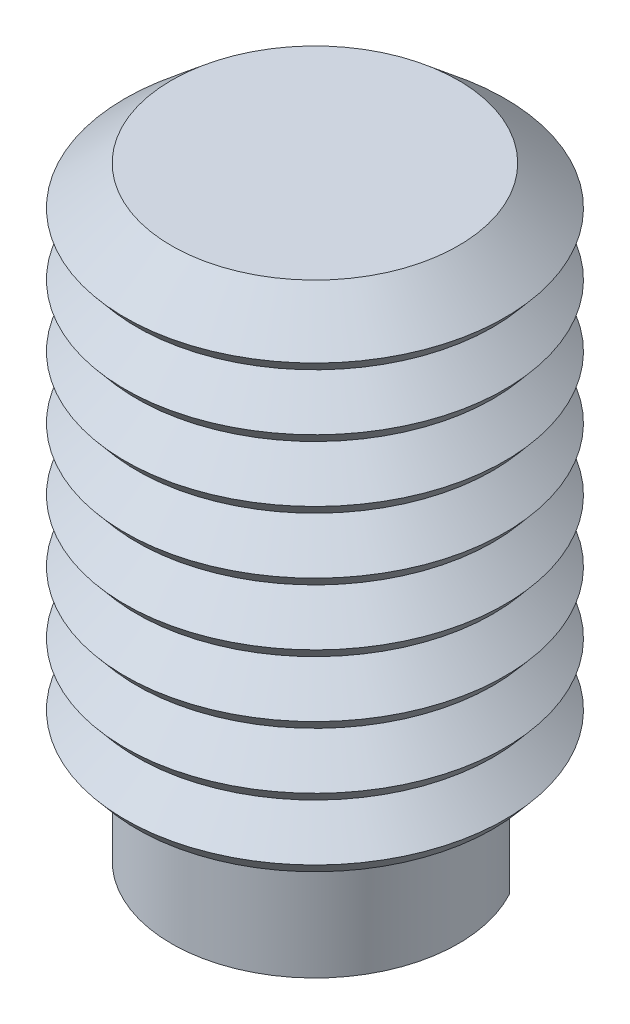
from build123d import *

# Parameters (mm, degrees)
SKETCH2_R                      = 8.45
CUT_EXTRUDE1_DEPTH             = 39
SKETCH3_W                      = 17.301460939
SKETCH3_H                      = 2.833887043
BOSS_EXTRUDE1_DEPTH            = 0.25
CUT_EXTRUDE2_REACH             = 41.416
SKETCH4_R                      = 1
CUT_EXTRUDE2_DIRECTION_2_DEPTH = 6
BOSS_EXTRUDE6_DEPTH            = 0.25
CUT_EXTRUDE5_REACH             = 43.334
SKETCH19_R                     = 1
CUT_EXTRUDE5_DIRECTION_2_REACH = 43.334
BOSS_EXTRUDE14_DEPTH           = 0.25
CUT_EXTRUDE9_REACH             = 41.831
SKETCH30_R                     = 1
CUT_EXTRUDE9_DIRECTION_2_REACH = 41.831
SKETCH33_R                     = 11.45
SKETCH33_R_2                   = 8.45
BOSS_EXTRUDE15_DEPTH           = 2
CUT_EXTRUDE11_START            = -6
CUT_EXTRUDE11_DEPTH            = 6
CUT_EXTRUDE12_START            = -6
CUT_EXTRUDE12_DEPTH            = 6


with BuildPart() as part:
    # Sketch1 → Revolve1 (revolve)
    with BuildSketch(Plane.XY):
        Polygon((0, -10.882512798), (0, -13.182512798), (-11.45, -13.182512798), (-11.45, -3.589289336), (-14.195818585, -5.893304698), (-15.16, -4.744238033), (-11.45, -1.631178402), (-11.45, 1.368821598), (-14.195818585, -0.935193764), (-15.16, 0.213872901), (-11.45, 3.326932532), (-11.45, 6.326932532), (-14.195818585, 4.02291717), (-15.16, 5.171983835), (-11.45, 8.285043466), (-11.45, 11.285043466), (-14.195818585, 8.981028104), (-15.16, 10.130094769), (-11.45, 13.2431544), (-11.45, 16.2431544), (-14.195818585, 13.939139038), (-15.16, 15.088205703), (-11.45, 18.201265334), (-11.45, 21.201265334), (-14.195818585, 18.897249972), (-15.16, 20.046316637), (-11.45, 23.159376268), (-11.45, 26.159376268), (-14.195818585, 23.855360906), (-15.16, 25.004427571), (-11.45, 28.117487202), (-11.45, 31.117487202), (-14.195818585, 28.81347184), (-15.16, 29.962538505), (-11.45, 33.075598136), (0, 33.075598136), (0, 31.117487202), (-10, 31.117487202), (-10, -10.882512798), align=None)
    revolve(axis=Axis((0, 33.075598136, 0), (0, -1, 0)))

    # Sketch2 → Cut-Extrude1 (cut)
    with BuildSketch(Plane.XZ.offset(13.182512798)):
        Circle(SKETCH2_R)
    extrude(amount=-CUT_EXTRUDE1_DEPTH, mode=Mode.SUBTRACT)

    # Sketch3 → Boss-Extrude1 (add)
    with BuildSketch(Plane.XZ.offset(-31.117487202)):
        with Locations((2.443032834, -1.416943522)):
            Rectangle(SKETCH3_W, SKETCH3_H)
    extrude(amount=BOSS_EXTRUDE1_DEPTH)

    # Sketch4 → Cut-Extrude2 (cut, up to next)
    with BuildSketch(Plane.XY, mode=Mode.PRIVATE) as cut_extrude2_sk1:
        with Locations((-1.027932202, 9.533260315)):
            Circle(SKETCH4_R)
    cut_extrude2_tool1 = extrude(cut_extrude2_sk1.sketch, amount=-CUT_EXTRUDE2_REACH, mode=Mode.PRIVATE) & part.part
    # Sketch4 → Cut-Extrude2 (cut, up to next)
    with BuildSketch(Plane.XY, mode=Mode.PRIVATE) as cut_extrude2_sk2:
        with Locations((3.972067798, 9.533260315)):
            Circle(SKETCH4_R)
    cut_extrude2_tool2 = extrude(cut_extrude2_sk2.sketch, amount=-CUT_EXTRUDE2_REACH, mode=Mode.PRIVATE) & part.part
    # Sketch4 → Cut-Extrude2 (cut, up to next)
    with BuildSketch(Plane.XY, mode=Mode.PRIVATE) as cut_extrude2_sk3:
        with Locations((-1.027932202, 14.533260315)):
            Circle(SKETCH4_R)
    cut_extrude2_tool3 = extrude(cut_extrude2_sk3.sketch, amount=-CUT_EXTRUDE2_REACH, mode=Mode.PRIVATE) & part.part
    # Sketch4 → Cut-Extrude2 (cut, up to next)
    with BuildSketch(Plane.XY, mode=Mode.PRIVATE) as cut_extrude2_sk4:
        with Locations((3.972067798, 14.533260315)):
            Circle(SKETCH4_R)
    cut_extrude2_tool4 = extrude(cut_extrude2_sk4.sketch, amount=-CUT_EXTRUDE2_REACH, mode=Mode.PRIVATE) & part.part
    # Sketch4 → Cut-Extrude2 (cut, up to next)
    with BuildSketch(Plane.XY, mode=Mode.PRIVATE) as cut_extrude2_sk5:
        with Locations((-1.027932202, 19.533260315)):
            Circle(SKETCH4_R)
    cut_extrude2_tool5 = extrude(cut_extrude2_sk5.sketch, amount=-CUT_EXTRUDE2_REACH, mode=Mode.PRIVATE) & part.part
    # Sketch4 → Cut-Extrude2 (cut, up to next)
    with BuildSketch(Plane.XY, mode=Mode.PRIVATE) as cut_extrude2_sk6:
        with Locations((3.972067798, 19.533260315)):
            Circle(SKETCH4_R)
    cut_extrude2_tool6 = extrude(cut_extrude2_sk6.sketch, amount=-CUT_EXTRUDE2_REACH, mode=Mode.PRIVATE) & part.part
    # Sketch4 → Cut-Extrude2 (cut, up to next)
    with BuildSketch(Plane.XY, mode=Mode.PRIVATE) as cut_extrude2_sk7:
        with Locations((-1.027932202, 4.533260315)):
            Circle(SKETCH4_R)
    cut_extrude2_tool7 = extrude(cut_extrude2_sk7.sketch, amount=-CUT_EXTRUDE2_REACH, mode=Mode.PRIVATE) & part.part
    # Sketch4 → Cut-Extrude2 (cut, up to next)
    with BuildSketch(Plane.XY, mode=Mode.PRIVATE) as cut_extrude2_sk8:
        with Locations((3.972067798, 4.533260315)):
            Circle(SKETCH4_R)
    cut_extrude2_tool8 = extrude(cut_extrude2_sk8.sketch, amount=-CUT_EXTRUDE2_REACH, mode=Mode.PRIVATE) & part.part
    # Sketch4 → Cut-Extrude2 (cut, up to next)
    with BuildSketch(Plane.XY, mode=Mode.PRIVATE) as cut_extrude2_sk9:
        with Locations((-1.027932202, -0.466739685)):
            Circle(SKETCH4_R)
    cut_extrude2_tool9 = extrude(cut_extrude2_sk9.sketch, amount=-CUT_EXTRUDE2_REACH, mode=Mode.PRIVATE) & part.part
    # Sketch4 → Cut-Extrude2 (cut, up to next)
    with BuildSketch(Plane.XY, mode=Mode.PRIVATE) as cut_extrude2_sk10:
        with Locations((3.972067798, -0.466739685)):
            Circle(SKETCH4_R)
    cut_extrude2_tool10 = extrude(cut_extrude2_sk10.sketch, amount=-CUT_EXTRUDE2_REACH, mode=Mode.PRIVATE) & part.part
    # Sketch4 → Cut-Extrude2 (cut, up to next)
    with BuildSketch(Plane.XY, mode=Mode.PRIVATE) as cut_extrude2_sk11:
        with Locations((-1.027932202, -5.466739685)):
            Circle(SKETCH4_R)
    cut_extrude2_tool11 = extrude(cut_extrude2_sk11.sketch, amount=-CUT_EXTRUDE2_REACH, mode=Mode.PRIVATE) & part.part
    # Sketch4 → Cut-Extrude2 (cut, up to next)
    with BuildSketch(Plane.XY, mode=Mode.PRIVATE) as cut_extrude2_sk12:
        with Locations((3.972067798, -5.466739685)):
            Circle(SKETCH4_R)
    cut_extrude2_tool12 = extrude(cut_extrude2_sk12.sketch, amount=-CUT_EXTRUDE2_REACH, mode=Mode.PRIVATE) & part.part
    add(cut_extrude2_tool1.solids().sort_by_distance((-1.027932, 9.53326, 0))[0], mode=Mode.SUBTRACT)
    add(cut_extrude2_tool2.solids().sort_by_distance((3.972068, 9.53326, 0))[0], mode=Mode.SUBTRACT)
    add(cut_extrude2_tool3.solids().sort_by_distance((-1.027932, 14.53326, 0))[0], mode=Mode.SUBTRACT)
    add(cut_extrude2_tool4.solids().sort_by_distance((3.972068, 14.53326, 0))[0], mode=Mode.SUBTRACT)
    add(cut_extrude2_tool5.solids().sort_by_distance((-1.027932, 19.53326, 0))[0], mode=Mode.SUBTRACT)
    add(cut_extrude2_tool6.solids().sort_by_distance((3.972068, 19.53326, 0))[0], mode=Mode.SUBTRACT)
    add(cut_extrude2_tool7.solids().sort_by_distance((-1.027932, 4.53326, 0))[0], mode=Mode.SUBTRACT)
    add(cut_extrude2_tool8.solids().sort_by_distance((3.972068, 4.53326, 0))[0], mode=Mode.SUBTRACT)
    add(cut_extrude2_tool9.solids().sort_by_distance((-1.027932, -0.46674, 0))[0], mode=Mode.SUBTRACT)
    add(cut_extrude2_tool10.solids().sort_by_distance((3.972068, -0.46674, 0))[0], mode=Mode.SUBTRACT)
    add(cut_extrude2_tool11.solids().sort_by_distance((-1.027932, -5.46674, 0))[0], mode=Mode.SUBTRACT)
    add(cut_extrude2_tool12.solids().sort_by_distance((3.972068, -5.46674, 0))[0], mode=Mode.SUBTRACT)

    # Sketch4 → Cut-Extrude2 direction 2 (cut)
    with BuildSketch(Plane.XY):
        with Locations((-1.027932202, 9.533260315)):
            Circle(SKETCH4_R)
        with Locations((3.972067798, 9.533260315)):
            Circle(SKETCH4_R)
        with Locations((-1.027932202, 14.533260315)):
            Circle(SKETCH4_R)
        with Locations((3.972067798, 14.533260315)):
            Circle(SKETCH4_R)
        with Locations((-1.027932202, 19.533260315)):
            Circle(SKETCH4_R)
        with Locations((3.972067798, 19.533260315)):
            Circle(SKETCH4_R)
        with Locations((-1.027932202, 4.533260315)):
            Circle(SKETCH4_R)
        with Locations((3.972067798, 4.533260315)):
            Circle(SKETCH4_R)
        with Locations((-1.027932202, -0.466739685)):
            Circle(SKETCH4_R)
        with Locations((3.972067798, -0.466739685)):
            Circle(SKETCH4_R)
        with Locations((-1.027932202, -5.466739685)):
            Circle(SKETCH4_R)
        with Locations((3.972067798, -5.466739685)):
            Circle(SKETCH4_R)
    extrude(amount=CUT_EXTRUDE2_DIRECTION_2_DEPTH, mode=Mode.SUBTRACT)

    # Sketch17 → Boss-Extrude6 (add)
    with BuildSketch(Plane(origin=(0, 30.867487202, 0), x_dir=(-1, 0, 0), z_dir=(0, -1, 0))):
        Polygon((3.298604231, 2.303596172), (3.576446897, 1.270155169), (4.610354392, 0.994053476), (5.36641922, 1.751392785), (5.088576553, 2.784833787), (4.054669058, 3.06093548), align=None)
    extrude(amount=BOSS_EXTRUDE6_DEPTH)

    # Sketch19 → Cut-Extrude5 (cut, up to next)
    with BuildSketch(Plane(origin=(-3.653826945, 0, -0.982338634), x_dir=(0.2596323868469691, 0, -0.9657075249267482), z_dir=(0.965707524926748, 0, 0.25963238684696904)), mode=Mode.PRIVATE) as cut_extrude5_sk1:
        with Locations((-0.867962211, 9.634300823)):
            Circle(SKETCH19_R)
    cut_extrude5_tool1 = extrude(cut_extrude5_sk1.sketch, amount=-CUT_EXTRUDE5_REACH, mode=Mode.PRIVATE) & part.part
    # Sketch19 → Cut-Extrude5 (cut, up to next)
    with BuildSketch(Plane(origin=(-3.653826945, 0, -0.982338634), x_dir=(0.2596323868469691, 0, -0.9657075249267482), z_dir=(0.965707524926748, 0, 0.25963238684696904)), mode=Mode.PRIVATE) as cut_extrude5_sk2:
        with Locations((4.132037789, 9.634300823)):
            Circle(SKETCH19_R)
    cut_extrude5_tool2 = extrude(cut_extrude5_sk2.sketch, amount=-CUT_EXTRUDE5_REACH, mode=Mode.PRIVATE) & part.part
    # Sketch19 → Cut-Extrude5 (cut, up to next)
    with BuildSketch(Plane(origin=(-3.653826945, 0, -0.982338634), x_dir=(0.2596323868469691, 0, -0.9657075249267482), z_dir=(0.965707524926748, 0, 0.25963238684696904)), mode=Mode.PRIVATE) as cut_extrude5_sk3:
        with Locations((-5.867962211, 9.634300823)):
            Circle(SKETCH19_R)
    cut_extrude5_tool3 = extrude(cut_extrude5_sk3.sketch, amount=-CUT_EXTRUDE5_REACH, mode=Mode.PRIVATE) & part.part
    # Sketch19 → Cut-Extrude5 (cut, up to next)
    with BuildSketch(Plane(origin=(-3.653826945, 0, -0.982338634), x_dir=(0.2596323868469691, 0, -0.9657075249267482), z_dir=(0.965707524926748, 0, 0.25963238684696904)), mode=Mode.PRIVATE) as cut_extrude5_sk4:
        with Locations((4.132037789, 14.634300823)):
            Circle(SKETCH19_R)
    cut_extrude5_tool4 = extrude(cut_extrude5_sk4.sketch, amount=-CUT_EXTRUDE5_REACH, mode=Mode.PRIVATE) & part.part
    # Sketch19 → Cut-Extrude5 (cut, up to next)
    with BuildSketch(Plane(origin=(-3.653826945, 0, -0.982338634), x_dir=(0.2596323868469691, 0, -0.9657075249267482), z_dir=(0.965707524926748, 0, 0.25963238684696904)), mode=Mode.PRIVATE) as cut_extrude5_sk5:
        with Locations((-0.867962211, 14.634300823)):
            Circle(SKETCH19_R)
    cut_extrude5_tool5 = extrude(cut_extrude5_sk5.sketch, amount=-CUT_EXTRUDE5_REACH, mode=Mode.PRIVATE) & part.part
    # Sketch19 → Cut-Extrude5 (cut, up to next)
    with BuildSketch(Plane(origin=(-3.653826945, 0, -0.982338634), x_dir=(0.2596323868469691, 0, -0.9657075249267482), z_dir=(0.965707524926748, 0, 0.25963238684696904)), mode=Mode.PRIVATE) as cut_extrude5_sk6:
        with Locations((-5.867962211, 14.634300823)):
            Circle(SKETCH19_R)
    cut_extrude5_tool6 = extrude(cut_extrude5_sk6.sketch, amount=-CUT_EXTRUDE5_REACH, mode=Mode.PRIVATE) & part.part
    # Sketch19 → Cut-Extrude5 (cut, up to next)
    with BuildSketch(Plane(origin=(-3.653826945, 0, -0.982338634), x_dir=(0.2596323868469691, 0, -0.9657075249267482), z_dir=(0.965707524926748, 0, 0.25963238684696904)), mode=Mode.PRIVATE) as cut_extrude5_sk7:
        with Locations((4.132037789, 19.634300823)):
            Circle(SKETCH19_R)
    cut_extrude5_tool7 = extrude(cut_extrude5_sk7.sketch, amount=-CUT_EXTRUDE5_REACH, mode=Mode.PRIVATE) & part.part
    # Sketch19 → Cut-Extrude5 (cut, up to next)
    with BuildSketch(Plane(origin=(-3.653826945, 0, -0.982338634), x_dir=(0.2596323868469691, 0, -0.9657075249267482), z_dir=(0.965707524926748, 0, 0.25963238684696904)), mode=Mode.PRIVATE) as cut_extrude5_sk8:
        with Locations((-5.867962211, 19.634300823)):
            Circle(SKETCH19_R)
    cut_extrude5_tool8 = extrude(cut_extrude5_sk8.sketch, amount=-CUT_EXTRUDE5_REACH, mode=Mode.PRIVATE) & part.part
    # Sketch19 → Cut-Extrude5 (cut, up to next)
    with BuildSketch(Plane(origin=(-3.653826945, 0, -0.982338634), x_dir=(0.2596323868469691, 0, -0.9657075249267482), z_dir=(0.965707524926748, 0, 0.25963238684696904)), mode=Mode.PRIVATE) as cut_extrude5_sk9:
        with Locations((4.132037789, 4.634300823)):
            Circle(SKETCH19_R)
    cut_extrude5_tool9 = extrude(cut_extrude5_sk9.sketch, amount=-CUT_EXTRUDE5_REACH, mode=Mode.PRIVATE) & part.part
    # Sketch19 → Cut-Extrude5 (cut, up to next)
    with BuildSketch(Plane(origin=(-3.653826945, 0, -0.982338634), x_dir=(0.2596323868469691, 0, -0.9657075249267482), z_dir=(0.965707524926748, 0, 0.25963238684696904)), mode=Mode.PRIVATE) as cut_extrude5_sk10:
        with Locations((-0.867962211, 4.634300823)):
            Circle(SKETCH19_R)
    cut_extrude5_tool10 = extrude(cut_extrude5_sk10.sketch, amount=-CUT_EXTRUDE5_REACH, mode=Mode.PRIVATE) & part.part
    # Sketch19 → Cut-Extrude5 (cut, up to next)
    with BuildSketch(Plane(origin=(-3.653826945, 0, -0.982338634), x_dir=(0.2596323868469691, 0, -0.9657075249267482), z_dir=(0.965707524926748, 0, 0.25963238684696904)), mode=Mode.PRIVATE) as cut_extrude5_sk11:
        with Locations((-5.867962211, 4.634300823)):
            Circle(SKETCH19_R)
    cut_extrude5_tool11 = extrude(cut_extrude5_sk11.sketch, amount=-CUT_EXTRUDE5_REACH, mode=Mode.PRIVATE) & part.part
    # Sketch19 → Cut-Extrude5 (cut, up to next)
    with BuildSketch(Plane(origin=(-3.653826945, 0, -0.982338634), x_dir=(0.2596323868469691, 0, -0.9657075249267482), z_dir=(0.965707524926748, 0, 0.25963238684696904)), mode=Mode.PRIVATE) as cut_extrude5_sk12:
        with Locations((4.132037789, -0.365699177)):
            Circle(SKETCH19_R)
    cut_extrude5_tool12 = extrude(cut_extrude5_sk12.sketch, amount=-CUT_EXTRUDE5_REACH, mode=Mode.PRIVATE) & part.part
    # Sketch19 → Cut-Extrude5 (cut, up to next)
    with BuildSketch(Plane(origin=(-3.653826945, 0, -0.982338634), x_dir=(0.2596323868469691, 0, -0.9657075249267482), z_dir=(0.965707524926748, 0, 0.25963238684696904)), mode=Mode.PRIVATE) as cut_extrude5_sk13:
        with Locations((-0.867962211, -0.365699177)):
            Circle(SKETCH19_R)
    cut_extrude5_tool13 = extrude(cut_extrude5_sk13.sketch, amount=-CUT_EXTRUDE5_REACH, mode=Mode.PRIVATE) & part.part
    # Sketch19 → Cut-Extrude5 (cut, up to next)
    with BuildSketch(Plane(origin=(-3.653826945, 0, -0.982338634), x_dir=(0.2596323868469691, 0, -0.9657075249267482), z_dir=(0.965707524926748, 0, 0.25963238684696904)), mode=Mode.PRIVATE) as cut_extrude5_sk14:
        with Locations((-5.867962211, -0.365699177)):
            Circle(SKETCH19_R)
    cut_extrude5_tool14 = extrude(cut_extrude5_sk14.sketch, amount=-CUT_EXTRUDE5_REACH, mode=Mode.PRIVATE) & part.part
    # Sketch19 → Cut-Extrude5 (cut, up to next)
    with BuildSketch(Plane(origin=(-3.653826945, 0, -0.982338634), x_dir=(0.2596323868469691, 0, -0.9657075249267482), z_dir=(0.965707524926748, 0, 0.25963238684696904)), mode=Mode.PRIVATE) as cut_extrude5_sk15:
        with Locations((4.132037789, -5.365699177)):
            Circle(SKETCH19_R)
    cut_extrude5_tool15 = extrude(cut_extrude5_sk15.sketch, amount=-CUT_EXTRUDE5_REACH, mode=Mode.PRIVATE) & part.part
    # Sketch19 → Cut-Extrude5 (cut, up to next)
    with BuildSketch(Plane(origin=(-3.653826945, 0, -0.982338634), x_dir=(0.2596323868469691, 0, -0.9657075249267482), z_dir=(0.965707524926748, 0, 0.25963238684696904)), mode=Mode.PRIVATE) as cut_extrude5_sk16:
        with Locations((-0.867962211, -5.365699177)):
            Circle(SKETCH19_R)
    cut_extrude5_tool16 = extrude(cut_extrude5_sk16.sketch, amount=-CUT_EXTRUDE5_REACH, mode=Mode.PRIVATE) & part.part
    # Sketch19 → Cut-Extrude5 (cut, up to next)
    with BuildSketch(Plane(origin=(-3.653826945, 0, -0.982338634), x_dir=(0.2596323868469691, 0, -0.9657075249267482), z_dir=(0.965707524926748, 0, 0.25963238684696904)), mode=Mode.PRIVATE) as cut_extrude5_sk17:
        with Locations((-5.867962211, -5.365699177)):
            Circle(SKETCH19_R)
    cut_extrude5_tool17 = extrude(cut_extrude5_sk17.sketch, amount=-CUT_EXTRUDE5_REACH, mode=Mode.PRIVATE) & part.part
    # Sketch19 → Cut-Extrude5 (cut, up to next)
    with BuildSketch(Plane(origin=(-3.653826945, 0, -0.982338634), x_dir=(0.2596323868469691, 0, -0.9657075249267482), z_dir=(0.965707524926748, 0, 0.25963238684696904)), mode=Mode.PRIVATE) as cut_extrude5_sk18:
        with Locations((-0.867962211, 19.634300823)):
            Circle(SKETCH19_R)
    cut_extrude5_tool18 = extrude(cut_extrude5_sk18.sketch, amount=-CUT_EXTRUDE5_REACH, mode=Mode.PRIVATE) & part.part
    add(cut_extrude5_tool1.solids().sort_by_distance((-3.879178, 9.634301, -0.144141))[0], mode=Mode.SUBTRACT)
    add(cut_extrude5_tool2.solids().sort_by_distance((-2.581016, 9.634301, -4.972679))[0], mode=Mode.SUBTRACT)
    add(cut_extrude5_tool3.solids().sort_by_distance((-5.17734, 9.634301, 4.684397))[0], mode=Mode.SUBTRACT)
    add(cut_extrude5_tool4.solids().sort_by_distance((-2.581016, 14.634301, -4.972679))[0], mode=Mode.SUBTRACT)
    add(cut_extrude5_tool5.solids().sort_by_distance((-3.879178, 14.634301, -0.144141))[0], mode=Mode.SUBTRACT)
    add(cut_extrude5_tool6.solids().sort_by_distance((-5.17734, 14.634301, 4.684397))[0], mode=Mode.SUBTRACT)
    add(cut_extrude5_tool7.solids().sort_by_distance((-2.581016, 19.634301, -4.972679))[0], mode=Mode.SUBTRACT)
    add(cut_extrude5_tool8.solids().sort_by_distance((-5.17734, 19.634301, 4.684397))[0], mode=Mode.SUBTRACT)
    add(cut_extrude5_tool9.solids().sort_by_distance((-2.581016, 4.634301, -4.972679))[0], mode=Mode.SUBTRACT)
    add(cut_extrude5_tool10.solids().sort_by_distance((-3.879178, 4.634301, -0.144141))[0], mode=Mode.SUBTRACT)
    add(cut_extrude5_tool11.solids().sort_by_distance((-5.17734, 4.634301, 4.684397))[0], mode=Mode.SUBTRACT)
    add(cut_extrude5_tool12.solids().sort_by_distance((-2.581016, -0.365699, -4.972679))[0], mode=Mode.SUBTRACT)
    add(cut_extrude5_tool13.solids().sort_by_distance((-3.879178, -0.365699, -0.144141))[0], mode=Mode.SUBTRACT)
    add(cut_extrude5_tool14.solids().sort_by_distance((-5.17734, -0.365699, 4.684397))[0], mode=Mode.SUBTRACT)
    add(cut_extrude5_tool15.solids().sort_by_distance((-2.581016, -5.365699, -4.972679))[0], mode=Mode.SUBTRACT)
    add(cut_extrude5_tool16.solids().sort_by_distance((-3.879178, -5.365699, -0.144141))[0], mode=Mode.SUBTRACT)
    add(cut_extrude5_tool17.solids().sort_by_distance((-5.17734, -5.365699, 4.684397))[0], mode=Mode.SUBTRACT)
    add(cut_extrude5_tool18.solids().sort_by_distance((-3.879178, 19.634301, -0.144141))[0], mode=Mode.SUBTRACT)

    # Sketch19 → Cut-Extrude5 direction 2 (cut, up to next)
    with BuildSketch(Plane(origin=(-3.653826945, 0, -0.982338634), x_dir=(0.2596323868469691, 0, -0.9657075249267482), z_dir=(0.965707524926748, 0, 0.25963238684696904)), mode=Mode.PRIVATE) as cut_extrude5_direction_2_sk1:
        with Locations((-0.867962211, 9.634300823)):
            Circle(SKETCH19_R)
    cut_extrude5_direction_2_tool1 = extrude(cut_extrude5_direction_2_sk1.sketch, amount=CUT_EXTRUDE5_DIRECTION_2_REACH, mode=Mode.PRIVATE) & part.part
    # Sketch19 → Cut-Extrude5 direction 2 (cut, up to next)
    with BuildSketch(Plane(origin=(-3.653826945, 0, -0.982338634), x_dir=(0.2596323868469691, 0, -0.9657075249267482), z_dir=(0.965707524926748, 0, 0.25963238684696904)), mode=Mode.PRIVATE) as cut_extrude5_direction_2_sk2:
        with Locations((4.132037789, 9.634300823)):
            Circle(SKETCH19_R)
    cut_extrude5_direction_2_tool2 = extrude(cut_extrude5_direction_2_sk2.sketch, amount=CUT_EXTRUDE5_DIRECTION_2_REACH, mode=Mode.PRIVATE) & part.part
    # Sketch19 → Cut-Extrude5 direction 2 (cut, up to next)
    with BuildSketch(Plane(origin=(-3.653826945, 0, -0.982338634), x_dir=(0.2596323868469691, 0, -0.9657075249267482), z_dir=(0.965707524926748, 0, 0.25963238684696904)), mode=Mode.PRIVATE) as cut_extrude5_direction_2_sk3:
        with Locations((-5.867962211, 9.634300823)):
            Circle(SKETCH19_R)
    cut_extrude5_direction_2_tool3 = extrude(cut_extrude5_direction_2_sk3.sketch, amount=CUT_EXTRUDE5_DIRECTION_2_REACH, mode=Mode.PRIVATE) & part.part
    # Sketch19 → Cut-Extrude5 direction 2 (cut, up to next)
    with BuildSketch(Plane(origin=(-3.653826945, 0, -0.982338634), x_dir=(0.2596323868469691, 0, -0.9657075249267482), z_dir=(0.965707524926748, 0, 0.25963238684696904)), mode=Mode.PRIVATE) as cut_extrude5_direction_2_sk4:
        with Locations((4.132037789, 14.634300823)):
            Circle(SKETCH19_R)
    cut_extrude5_direction_2_tool4 = extrude(cut_extrude5_direction_2_sk4.sketch, amount=CUT_EXTRUDE5_DIRECTION_2_REACH, mode=Mode.PRIVATE) & part.part
    # Sketch19 → Cut-Extrude5 direction 2 (cut, up to next)
    with BuildSketch(Plane(origin=(-3.653826945, 0, -0.982338634), x_dir=(0.2596323868469691, 0, -0.9657075249267482), z_dir=(0.965707524926748, 0, 0.25963238684696904)), mode=Mode.PRIVATE) as cut_extrude5_direction_2_sk5:
        with Locations((-0.867962211, 14.634300823)):
            Circle(SKETCH19_R)
    cut_extrude5_direction_2_tool5 = extrude(cut_extrude5_direction_2_sk5.sketch, amount=CUT_EXTRUDE5_DIRECTION_2_REACH, mode=Mode.PRIVATE) & part.part
    # Sketch19 → Cut-Extrude5 direction 2 (cut, up to next)
    with BuildSketch(Plane(origin=(-3.653826945, 0, -0.982338634), x_dir=(0.2596323868469691, 0, -0.9657075249267482), z_dir=(0.965707524926748, 0, 0.25963238684696904)), mode=Mode.PRIVATE) as cut_extrude5_direction_2_sk6:
        with Locations((-5.867962211, 14.634300823)):
            Circle(SKETCH19_R)
    cut_extrude5_direction_2_tool6 = extrude(cut_extrude5_direction_2_sk6.sketch, amount=CUT_EXTRUDE5_DIRECTION_2_REACH, mode=Mode.PRIVATE) & part.part
    # Sketch19 → Cut-Extrude5 direction 2 (cut, up to next)
    with BuildSketch(Plane(origin=(-3.653826945, 0, -0.982338634), x_dir=(0.2596323868469691, 0, -0.9657075249267482), z_dir=(0.965707524926748, 0, 0.25963238684696904)), mode=Mode.PRIVATE) as cut_extrude5_direction_2_sk7:
        with Locations((4.132037789, 19.634300823)):
            Circle(SKETCH19_R)
    cut_extrude5_direction_2_tool7 = extrude(cut_extrude5_direction_2_sk7.sketch, amount=CUT_EXTRUDE5_DIRECTION_2_REACH, mode=Mode.PRIVATE) & part.part
    # Sketch19 → Cut-Extrude5 direction 2 (cut, up to next)
    with BuildSketch(Plane(origin=(-3.653826945, 0, -0.982338634), x_dir=(0.2596323868469691, 0, -0.9657075249267482), z_dir=(0.965707524926748, 0, 0.25963238684696904)), mode=Mode.PRIVATE) as cut_extrude5_direction_2_sk8:
        with Locations((-5.867962211, 19.634300823)):
            Circle(SKETCH19_R)
    cut_extrude5_direction_2_tool8 = extrude(cut_extrude5_direction_2_sk8.sketch, amount=CUT_EXTRUDE5_DIRECTION_2_REACH, mode=Mode.PRIVATE) & part.part
    # Sketch19 → Cut-Extrude5 direction 2 (cut, up to next)
    with BuildSketch(Plane(origin=(-3.653826945, 0, -0.982338634), x_dir=(0.2596323868469691, 0, -0.9657075249267482), z_dir=(0.965707524926748, 0, 0.25963238684696904)), mode=Mode.PRIVATE) as cut_extrude5_direction_2_sk9:
        with Locations((4.132037789, 4.634300823)):
            Circle(SKETCH19_R)
    cut_extrude5_direction_2_tool9 = extrude(cut_extrude5_direction_2_sk9.sketch, amount=CUT_EXTRUDE5_DIRECTION_2_REACH, mode=Mode.PRIVATE) & part.part
    # Sketch19 → Cut-Extrude5 direction 2 (cut, up to next)
    with BuildSketch(Plane(origin=(-3.653826945, 0, -0.982338634), x_dir=(0.2596323868469691, 0, -0.9657075249267482), z_dir=(0.965707524926748, 0, 0.25963238684696904)), mode=Mode.PRIVATE) as cut_extrude5_direction_2_sk10:
        with Locations((-0.867962211, 4.634300823)):
            Circle(SKETCH19_R)
    cut_extrude5_direction_2_tool10 = extrude(cut_extrude5_direction_2_sk10.sketch, amount=CUT_EXTRUDE5_DIRECTION_2_REACH, mode=Mode.PRIVATE) & part.part
    # Sketch19 → Cut-Extrude5 direction 2 (cut, up to next)
    with BuildSketch(Plane(origin=(-3.653826945, 0, -0.982338634), x_dir=(0.2596323868469691, 0, -0.9657075249267482), z_dir=(0.965707524926748, 0, 0.25963238684696904)), mode=Mode.PRIVATE) as cut_extrude5_direction_2_sk11:
        with Locations((-5.867962211, 4.634300823)):
            Circle(SKETCH19_R)
    cut_extrude5_direction_2_tool11 = extrude(cut_extrude5_direction_2_sk11.sketch, amount=CUT_EXTRUDE5_DIRECTION_2_REACH, mode=Mode.PRIVATE) & part.part
    # Sketch19 → Cut-Extrude5 direction 2 (cut, up to next)
    with BuildSketch(Plane(origin=(-3.653826945, 0, -0.982338634), x_dir=(0.2596323868469691, 0, -0.9657075249267482), z_dir=(0.965707524926748, 0, 0.25963238684696904)), mode=Mode.PRIVATE) as cut_extrude5_direction_2_sk12:
        with Locations((4.132037789, -0.365699177)):
            Circle(SKETCH19_R)
    cut_extrude5_direction_2_tool12 = extrude(cut_extrude5_direction_2_sk12.sketch, amount=CUT_EXTRUDE5_DIRECTION_2_REACH, mode=Mode.PRIVATE) & part.part
    # Sketch19 → Cut-Extrude5 direction 2 (cut, up to next)
    with BuildSketch(Plane(origin=(-3.653826945, 0, -0.982338634), x_dir=(0.2596323868469691, 0, -0.9657075249267482), z_dir=(0.965707524926748, 0, 0.25963238684696904)), mode=Mode.PRIVATE) as cut_extrude5_direction_2_sk13:
        with Locations((-0.867962211, -0.365699177)):
            Circle(SKETCH19_R)
    cut_extrude5_direction_2_tool13 = extrude(cut_extrude5_direction_2_sk13.sketch, amount=CUT_EXTRUDE5_DIRECTION_2_REACH, mode=Mode.PRIVATE) & part.part
    # Sketch19 → Cut-Extrude5 direction 2 (cut, up to next)
    with BuildSketch(Plane(origin=(-3.653826945, 0, -0.982338634), x_dir=(0.2596323868469691, 0, -0.9657075249267482), z_dir=(0.965707524926748, 0, 0.25963238684696904)), mode=Mode.PRIVATE) as cut_extrude5_direction_2_sk14:
        with Locations((-5.867962211, -0.365699177)):
            Circle(SKETCH19_R)
    cut_extrude5_direction_2_tool14 = extrude(cut_extrude5_direction_2_sk14.sketch, amount=CUT_EXTRUDE5_DIRECTION_2_REACH, mode=Mode.PRIVATE) & part.part
    # Sketch19 → Cut-Extrude5 direction 2 (cut, up to next)
    with BuildSketch(Plane(origin=(-3.653826945, 0, -0.982338634), x_dir=(0.2596323868469691, 0, -0.9657075249267482), z_dir=(0.965707524926748, 0, 0.25963238684696904)), mode=Mode.PRIVATE) as cut_extrude5_direction_2_sk15:
        with Locations((4.132037789, -5.365699177)):
            Circle(SKETCH19_R)
    cut_extrude5_direction_2_tool15 = extrude(cut_extrude5_direction_2_sk15.sketch, amount=CUT_EXTRUDE5_DIRECTION_2_REACH, mode=Mode.PRIVATE) & part.part
    # Sketch19 → Cut-Extrude5 direction 2 (cut, up to next)
    with BuildSketch(Plane(origin=(-3.653826945, 0, -0.982338634), x_dir=(0.2596323868469691, 0, -0.9657075249267482), z_dir=(0.965707524926748, 0, 0.25963238684696904)), mode=Mode.PRIVATE) as cut_extrude5_direction_2_sk16:
        with Locations((-0.867962211, -5.365699177)):
            Circle(SKETCH19_R)
    cut_extrude5_direction_2_tool16 = extrude(cut_extrude5_direction_2_sk16.sketch, amount=CUT_EXTRUDE5_DIRECTION_2_REACH, mode=Mode.PRIVATE) & part.part
    # Sketch19 → Cut-Extrude5 direction 2 (cut, up to next)
    with BuildSketch(Plane(origin=(-3.653826945, 0, -0.982338634), x_dir=(0.2596323868469691, 0, -0.9657075249267482), z_dir=(0.965707524926748, 0, 0.25963238684696904)), mode=Mode.PRIVATE) as cut_extrude5_direction_2_sk17:
        with Locations((-5.867962211, -5.365699177)):
            Circle(SKETCH19_R)
    cut_extrude5_direction_2_tool17 = extrude(cut_extrude5_direction_2_sk17.sketch, amount=CUT_EXTRUDE5_DIRECTION_2_REACH, mode=Mode.PRIVATE) & part.part
    # Sketch19 → Cut-Extrude5 direction 2 (cut, up to next)
    with BuildSketch(Plane(origin=(-3.653826945, 0, -0.982338634), x_dir=(0.2596323868469691, 0, -0.9657075249267482), z_dir=(0.965707524926748, 0, 0.25963238684696904)), mode=Mode.PRIVATE) as cut_extrude5_direction_2_sk18:
        with Locations((-0.867962211, 19.634300823)):
            Circle(SKETCH19_R)
    cut_extrude5_direction_2_tool18 = extrude(cut_extrude5_direction_2_sk18.sketch, amount=CUT_EXTRUDE5_DIRECTION_2_REACH, mode=Mode.PRIVATE) & part.part
    add(cut_extrude5_direction_2_tool1.solids().sort_by_distance((-3.879178, 9.634301, -0.144141))[0], mode=Mode.SUBTRACT)
    add(cut_extrude5_direction_2_tool2.solids().sort_by_distance((-2.581016, 9.634301, -4.972679))[0], mode=Mode.SUBTRACT)
    add(cut_extrude5_direction_2_tool3.solids().sort_by_distance((-5.17734, 9.634301, 4.684397))[0], mode=Mode.SUBTRACT)
    add(cut_extrude5_direction_2_tool4.solids().sort_by_distance((-2.581016, 14.634301, -4.972679))[0], mode=Mode.SUBTRACT)
    add(cut_extrude5_direction_2_tool5.solids().sort_by_distance((-3.879178, 14.634301, -0.144141))[0], mode=Mode.SUBTRACT)
    add(cut_extrude5_direction_2_tool6.solids().sort_by_distance((-5.17734, 14.634301, 4.684397))[0], mode=Mode.SUBTRACT)
    add(cut_extrude5_direction_2_tool7.solids().sort_by_distance((-2.581016, 19.634301, -4.972679))[0], mode=Mode.SUBTRACT)
    add(cut_extrude5_direction_2_tool8.solids().sort_by_distance((-5.17734, 19.634301, 4.684397))[0], mode=Mode.SUBTRACT)
    add(cut_extrude5_direction_2_tool9.solids().sort_by_distance((-2.581016, 4.634301, -4.972679))[0], mode=Mode.SUBTRACT)
    add(cut_extrude5_direction_2_tool10.solids().sort_by_distance((-3.879178, 4.634301, -0.144141))[0], mode=Mode.SUBTRACT)
    add(cut_extrude5_direction_2_tool11.solids().sort_by_distance((-5.17734, 4.634301, 4.684397))[0], mode=Mode.SUBTRACT)
    add(cut_extrude5_direction_2_tool12.solids().sort_by_distance((-2.581016, -0.365699, -4.972679))[0], mode=Mode.SUBTRACT)
    add(cut_extrude5_direction_2_tool13.solids().sort_by_distance((-3.879178, -0.365699, -0.144141))[0], mode=Mode.SUBTRACT)
    add(cut_extrude5_direction_2_tool14.solids().sort_by_distance((-5.17734, -0.365699, 4.684397))[0], mode=Mode.SUBTRACT)
    add(cut_extrude5_direction_2_tool15.solids().sort_by_distance((-2.581016, -5.365699, -4.972679))[0], mode=Mode.SUBTRACT)
    add(cut_extrude5_direction_2_tool16.solids().sort_by_distance((-3.879178, -5.365699, -0.144141))[0], mode=Mode.SUBTRACT)
    add(cut_extrude5_direction_2_tool17.solids().sort_by_distance((-5.17734, -5.365699, 4.684397))[0], mode=Mode.SUBTRACT)
    add(cut_extrude5_direction_2_tool18.solids().sort_by_distance((-3.879178, 19.634301, -0.144141))[0], mode=Mode.SUBTRACT)

    # Sketch29 → Boss-Extrude14 (add)
    with BuildSketch(Plane.XZ.offset(-30.867487202)):
        Polygon((3.970860082, -0.591960481), (4.234284785, -1.04822545), (4.761134189, -1.04822545), (5.024558892, -0.591960481), (4.761134189, -0.135695513), (4.234284785, -0.135695513), align=None)
    extrude(amount=BOSS_EXTRUDE14_DEPTH)

    # Sketch30 → Cut-Extrude9 (cut, up to next)
    with BuildSketch(Plane(origin=(0, 0, -1.04822545), x_dir=(-1, 0, 0), z_dir=(0, 0, -1)), mode=Mode.PRIVATE) as cut_extrude9_sk1:
        with Locations((1.445472759, 19.531579193)):
            Circle(SKETCH30_R)
    cut_extrude9_tool1 = extrude(cut_extrude9_sk1.sketch, amount=-CUT_EXTRUDE9_REACH, mode=Mode.PRIVATE) & part.part
    # Sketch30 → Cut-Extrude9 (cut, up to next)
    with BuildSketch(Plane(origin=(0, 0, -1.04822545), x_dir=(-1, 0, 0), z_dir=(0, 0, -1)), mode=Mode.PRIVATE) as cut_extrude9_sk2:
        with Locations((1.445472759, 14.531579193)):
            Circle(SKETCH30_R)
    cut_extrude9_tool2 = extrude(cut_extrude9_sk2.sketch, amount=-CUT_EXTRUDE9_REACH, mode=Mode.PRIVATE) & part.part
    # Sketch30 → Cut-Extrude9 (cut, up to next)
    with BuildSketch(Plane(origin=(0, 0, -1.04822545), x_dir=(-1, 0, 0), z_dir=(0, 0, -1)), mode=Mode.PRIVATE) as cut_extrude9_sk3:
        with Locations((1.445472759, 9.531579193)):
            Circle(SKETCH30_R)
    cut_extrude9_tool3 = extrude(cut_extrude9_sk3.sketch, amount=-CUT_EXTRUDE9_REACH, mode=Mode.PRIVATE) & part.part
    # Sketch30 → Cut-Extrude9 (cut, up to next)
    with BuildSketch(Plane(origin=(0, 0, -1.04822545), x_dir=(-1, 0, 0), z_dir=(0, 0, -1)), mode=Mode.PRIVATE) as cut_extrude9_sk4:
        with Locations((1.445472759, 4.531579193)):
            Circle(SKETCH30_R)
    cut_extrude9_tool4 = extrude(cut_extrude9_sk4.sketch, amount=-CUT_EXTRUDE9_REACH, mode=Mode.PRIVATE) & part.part
    # Sketch30 → Cut-Extrude9 (cut, up to next)
    with BuildSketch(Plane(origin=(0, 0, -1.04822545), x_dir=(-1, 0, 0), z_dir=(0, 0, -1)), mode=Mode.PRIVATE) as cut_extrude9_sk5:
        with Locations((1.445472759, -0.468420807)):
            Circle(SKETCH30_R)
    cut_extrude9_tool5 = extrude(cut_extrude9_sk5.sketch, amount=-CUT_EXTRUDE9_REACH, mode=Mode.PRIVATE) & part.part
    # Sketch30 → Cut-Extrude9 (cut, up to next)
    with BuildSketch(Plane(origin=(0, 0, -1.04822545), x_dir=(-1, 0, 0), z_dir=(0, 0, -1)), mode=Mode.PRIVATE) as cut_extrude9_sk6:
        with Locations((1.445472759, -5.468420807)):
            Circle(SKETCH30_R)
    cut_extrude9_tool6 = extrude(cut_extrude9_sk6.sketch, amount=-CUT_EXTRUDE9_REACH, mode=Mode.PRIVATE) & part.part
    add(cut_extrude9_tool1.solids().sort_by_distance((-1.445473, 19.531579, -1.048225))[0], mode=Mode.SUBTRACT)
    add(cut_extrude9_tool2.solids().sort_by_distance((-1.445473, 14.531579, -1.048225))[0], mode=Mode.SUBTRACT)
    add(cut_extrude9_tool3.solids().sort_by_distance((-1.445473, 9.531579, -1.048225))[0], mode=Mode.SUBTRACT)
    add(cut_extrude9_tool4.solids().sort_by_distance((-1.445473, 4.531579, -1.048225))[0], mode=Mode.SUBTRACT)
    add(cut_extrude9_tool5.solids().sort_by_distance((-1.445473, -0.468421, -1.048225))[0], mode=Mode.SUBTRACT)
    add(cut_extrude9_tool6.solids().sort_by_distance((-1.445473, -5.468421, -1.048225))[0], mode=Mode.SUBTRACT)

    # Sketch30 → Cut-Extrude9 direction 2 (cut, up to next)
    with BuildSketch(Plane(origin=(0, 0, -1.04822545), x_dir=(-1, 0, 0), z_dir=(0, 0, -1)), mode=Mode.PRIVATE) as cut_extrude9_direction_2_sk1:
        with Locations((1.445472759, 19.531579193)):
            Circle(SKETCH30_R)
    cut_extrude9_direction_2_tool1 = extrude(cut_extrude9_direction_2_sk1.sketch, amount=CUT_EXTRUDE9_DIRECTION_2_REACH, mode=Mode.PRIVATE) & part.part
    # Sketch30 → Cut-Extrude9 direction 2 (cut, up to next)
    with BuildSketch(Plane(origin=(0, 0, -1.04822545), x_dir=(-1, 0, 0), z_dir=(0, 0, -1)), mode=Mode.PRIVATE) as cut_extrude9_direction_2_sk2:
        with Locations((1.445472759, 14.531579193)):
            Circle(SKETCH30_R)
    cut_extrude9_direction_2_tool2 = extrude(cut_extrude9_direction_2_sk2.sketch, amount=CUT_EXTRUDE9_DIRECTION_2_REACH, mode=Mode.PRIVATE) & part.part
    # Sketch30 → Cut-Extrude9 direction 2 (cut, up to next)
    with BuildSketch(Plane(origin=(0, 0, -1.04822545), x_dir=(-1, 0, 0), z_dir=(0, 0, -1)), mode=Mode.PRIVATE) as cut_extrude9_direction_2_sk3:
        with Locations((1.445472759, 9.531579193)):
            Circle(SKETCH30_R)
    cut_extrude9_direction_2_tool3 = extrude(cut_extrude9_direction_2_sk3.sketch, amount=CUT_EXTRUDE9_DIRECTION_2_REACH, mode=Mode.PRIVATE) & part.part
    # Sketch30 → Cut-Extrude9 direction 2 (cut, up to next)
    with BuildSketch(Plane(origin=(0, 0, -1.04822545), x_dir=(-1, 0, 0), z_dir=(0, 0, -1)), mode=Mode.PRIVATE) as cut_extrude9_direction_2_sk4:
        with Locations((1.445472759, 4.531579193)):
            Circle(SKETCH30_R)
    cut_extrude9_direction_2_tool4 = extrude(cut_extrude9_direction_2_sk4.sketch, amount=CUT_EXTRUDE9_DIRECTION_2_REACH, mode=Mode.PRIVATE) & part.part
    # Sketch30 → Cut-Extrude9 direction 2 (cut, up to next)
    with BuildSketch(Plane(origin=(0, 0, -1.04822545), x_dir=(-1, 0, 0), z_dir=(0, 0, -1)), mode=Mode.PRIVATE) as cut_extrude9_direction_2_sk5:
        with Locations((1.445472759, -0.468420807)):
            Circle(SKETCH30_R)
    cut_extrude9_direction_2_tool5 = extrude(cut_extrude9_direction_2_sk5.sketch, amount=CUT_EXTRUDE9_DIRECTION_2_REACH, mode=Mode.PRIVATE) & part.part
    # Sketch30 → Cut-Extrude9 direction 2 (cut, up to next)
    with BuildSketch(Plane(origin=(0, 0, -1.04822545), x_dir=(-1, 0, 0), z_dir=(0, 0, -1)), mode=Mode.PRIVATE) as cut_extrude9_direction_2_sk6:
        with Locations((1.445472759, -5.468420807)):
            Circle(SKETCH30_R)
    cut_extrude9_direction_2_tool6 = extrude(cut_extrude9_direction_2_sk6.sketch, amount=CUT_EXTRUDE9_DIRECTION_2_REACH, mode=Mode.PRIVATE) & part.part
    add(cut_extrude9_direction_2_tool1.solids().sort_by_distance((-1.445473, 19.531579, -1.048225))[0], mode=Mode.SUBTRACT)
    add(cut_extrude9_direction_2_tool2.solids().sort_by_distance((-1.445473, 14.531579, -1.048225))[0], mode=Mode.SUBTRACT)
    add(cut_extrude9_direction_2_tool3.solids().sort_by_distance((-1.445473, 9.531579, -1.048225))[0], mode=Mode.SUBTRACT)
    add(cut_extrude9_direction_2_tool4.solids().sort_by_distance((-1.445473, 4.531579, -1.048225))[0], mode=Mode.SUBTRACT)
    add(cut_extrude9_direction_2_tool5.solids().sort_by_distance((-1.445473, -0.468421, -1.048225))[0], mode=Mode.SUBTRACT)
    add(cut_extrude9_direction_2_tool6.solids().sort_by_distance((-1.445473, -5.468421, -1.048225))[0], mode=Mode.SUBTRACT)

    # Sketch33 → Boss-Extrude15 (add)
    with BuildSketch(Plane.XZ.offset(13.182512798)):
        Circle(SKETCH33_R)
        Circle(SKETCH33_R_2, mode=Mode.SUBTRACT)
    extrude(amount=BOSS_EXTRUDE15_DEPTH)

    # Sketch35 → Cut-Extrude11 (cut)
    with BuildSketch(Plane.XZ.offset(15.182512798).offset(CUT_EXTRUDE11_START)):
        with BuildLine():
            Line((3.760536, -8.29946613), (3.487448896, -7.696765567))
            ThreePointArc((3.487448896, -7.696765567), (5.153800649, -6.696330254), (6.547486989, -5.341620927))
            Line((6.547486989, -5.341620927), (7.059229324, -5.759114474))
            ThreePointArc((7.059229324, -5.759114474), (8.546188377, -5.429738799), (10.069037495, -5.451328638))
            ThreePointArc((10.069037495, -5.451328638), (6.984555806, -9.072953224), (2.694438537, -11.128454563))
            ThreePointArc((2.694438537, -11.128454563), (3.062676041, -9.651851633), (3.760536, -8.29946613))
        make_face()
    extrude(amount=CUT_EXTRUDE11_DEPTH, mode=Mode.SUBTRACT)

    # Sketch37 → Cut-Extrude12 (cut)
    with BuildSketch(Plane.XZ.offset(15.182512798).offset(CUT_EXTRUDE12_START)):
        with BuildLine():
            Line((2.694438537, -11.128454563), (1.988472108, -8.212702276))
            ThreePointArc((1.988472108, -8.212702276), (2.750086432, -7.989963993), (3.487448896, -7.696765567))
            Line((3.487448896, -7.696765567), (3.760536, -8.29946613))
            ThreePointArc((3.760536, -8.29946613), (3.062676041, -9.651851633), (2.694438537, -11.128454563))
        make_face()
        with BuildLine():
            Line((10.069037495, -5.451328638), (7.430861732, -4.023032925))
            ThreePointArc((7.430861732, -4.023032925), (7.020201338, -4.703113137), (6.547486989, -5.341620927))
            Line((6.547486989, -5.341620927), (7.059229324, -5.759114474))
            ThreePointArc((7.059229324, -5.759114474), (8.546188377, -5.429738799), (10.069037495, -5.451328638))
        make_face()
    extrude(amount=CUT_EXTRUDE12_DEPTH, mode=Mode.SUBTRACT)


solid = part.part
